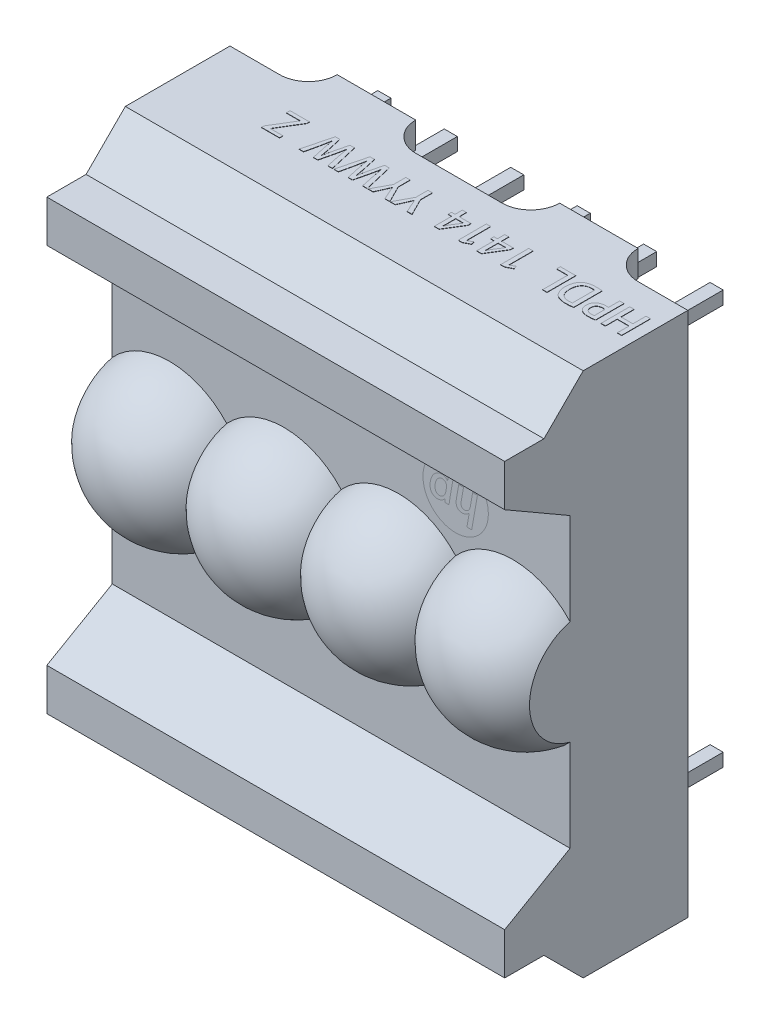
from build123d import *

# Parameters (mm, degrees)
EXTRUDE_1_DEPTH          = 8.75
SKETCH_2_W               = 3
SKETCH_2_H               = 1
EXTRUDE_2_DEPTH          = 1.1
FILLET_1_R               = 1.1
PATTERN_LINEAR_1_COUNT   = 4
PATTERN_LINEAR_1_PITCH   = 4.375
CUT_EXTRUDE_1_DEPTH      = 16.538465376
CUT_EXTRUDE_1_DEPTH_BACK = 16.538465376
SKETCH_5_W               = 0.5
SKETCH_5_H               = 0.5
EXTRUDE_3_DEPTH          = 3.5
WRAP_START               = 10.05
WRAP_1_DEPTH             = 0.01
WRAP_START_2             = -10.06
WRAP_2_DEPTH             = 0.01


# Read off the part's stored shape, not the designer's step: Перенос1, Перенос2
with BuildPart() as part:
    # Эскиз1 → Бобышка-Вытянуть1 (new, symmetric)
    with BuildSketch(Plane(origin=(0, 0, 0), x_dir=(0, 0, -1), z_dir=(1, 0, 0))):
        Polygon((0, 10.05), (0, -10.05), (-4, -10.05), (-5.5, -8.55), (-7, -8.55), (-7, -6.95), (-4.5, -5.506624327), (-4.5, 5.506624327), (-7, 6.95), (-7, 8.55), (-5.5, 8.55), (-4, 10.05), align=None)
    extrude(amount=EXTRUDE_1_DEPTH, both=True)

    # Эскиз2 → Бобышка-Вытянуть2 (add)
    with BuildSketch(Plane(origin=(0, 0, 0), x_dir=(-1, 0, 0), z_dir=(0, 0, -1))):
        with Locations((-4.25, 9.55)):
            Rectangle(SKETCH_2_W, SKETCH_2_H)
        with Locations((4.25, 9.55)):
            Rectangle(SKETCH_2_W, SKETCH_2_H)
        with Locations((4.25, -9.55)):
            Rectangle(SKETCH_2_W, SKETCH_2_H)
        with Locations((-4.25, -9.55)):
            Rectangle(SKETCH_2_W, SKETCH_2_H)
    extrude(amount=EXTRUDE_2_DEPTH)

    # Скругление1
    fillet_1_edges = [part.edges().sort_by_distance(p)[0] for p in [
        (-5.75, -9.55, 0),
        (-2.75, -9.55, 0),
        (2.75, -9.55, 0),
        (5.75, -9.55, 0),
        (-2.75, 9.55, 0),
        (-5.75, 9.55, 0),
        (2.75, 9.55, 0),
        (5.75, 9.55, 0),
    ]]
    fillet(fillet_1_edges, radius=FILLET_1_R - 0.0001)  # a hair under: the kernel refuses the full size

    # Эскиз3 → Повернуть1 (revolve)
    with BuildSketch(Plane(origin=(0, 0, 0), x_dir=(1, 0, 0), z_dir=(0, 1, 0))):
        with BuildLine():
            Line((-3.5625, -4), (-6.5625, -4))
            Line((-6.5625, -4), (-6.5625, -7))
            ThreePointArc((-6.5625, -7), (-4.441179656, -6.121320344), (-3.5625, -4))
        make_face()
    revolve_1 = revolve(axis=Axis((-6.5625, 0, 4), (0, 0, 1)))

    # Линейный массив1: Повернуть1 ×4
    with Locations(*[(i * PATTERN_LINEAR_1_PITCH, 0, 0) for i in range(1, PATTERN_LINEAR_1_COUNT)]):
        add(revolve_1)

    # Эскиз4 → Вырез-Вытянуть1 (cut, two sides: drawn at the far end of the back side and taken through both)
    with BuildSketch(Plane(origin=(0, 0, 0), x_dir=(-1, 0, 0), z_dir=(0, 0, -1)).offset(-CUT_EXTRUDE_1_DEPTH_BACK)):
        with BuildLine():
            Line((8.75, 2.053008463), (8.75, -2.053008463))
            ThreePointArc((8.75, -2.053008463), (9.5625, 0), (8.75, 2.053008463))
        make_face()
        with BuildLine():
            Line((-8.75, -2.053008463), (-8.75, 2.053008463))
            ThreePointArc((-8.75, 2.053008463), (-9.5625, 0), (-8.75, -2.053008463))
        make_face()
    extrude(amount=CUT_EXTRUDE_1_DEPTH + CUT_EXTRUDE_1_DEPTH_BACK, mode=Mode.SUBTRACT)

    # Эскиз5 → Бобышка-Вытянуть3 (add)
    with BuildSketch(Plane(origin=(0, 0, 0), x_dir=(-1, 0, 0), z_dir=(0, 0, -1))):
        with Locations((-1.27, 7.65)):
            Rectangle(SKETCH_5_W, SKETCH_5_H)
        with Locations((-3.81, 7.65)):
            Rectangle(SKETCH_5_W, SKETCH_5_H)
        with Locations((-6.35, 7.65)):
            Rectangle(SKETCH_5_W, SKETCH_5_H)
        with Locations((6.35, 7.65)):
            Rectangle(SKETCH_5_W, SKETCH_5_H)
        with Locations((3.81, 7.65)):
            Rectangle(SKETCH_5_W, SKETCH_5_H)
        with Locations((1.27, 7.65)):
            Rectangle(SKETCH_5_W, SKETCH_5_H)
        with Locations((1.27, -7.65)):
            Rectangle(SKETCH_5_W, SKETCH_5_H)
        with Locations((3.81, -7.65)):
            Rectangle(SKETCH_5_W, SKETCH_5_H)
        with Locations((6.35, -7.65)):
            Rectangle(SKETCH_5_W, SKETCH_5_H)
        with Locations((-6.35, -7.65)):
            Rectangle(SKETCH_5_W, SKETCH_5_H)
        with Locations((-3.81, -7.65)):
            Rectangle(SKETCH_5_W, SKETCH_5_H)
        with Locations((-1.27, -7.65)):
            Rectangle(SKETCH_5_W, SKETCH_5_H)
    extrude(amount=EXTRUDE_3_DEPTH)

    # Перенос1 outline → Перенос1 (add)
    # profile 1 of 13: a face of its own
    with BuildSketch(Plane(origin=(0, 0, 0), x_dir=(1, 0, 0), z_dir=(0, 1, 0)).offset(WRAP_START)):
        with BuildLine():
            Line((7.146040724, -1.00082936), (7.146040724, -1.432965852))
            add(Edge.make_bspline(
                [(7.146040724, -1.432965852), (7.138930586, -1.431805859), (7.124344074, -1.429426123), (7.101699216, -1.427237925), (7.077755807, -1.425949859), (7.061357972, -1.42597002), (7.052922323, -1.425980392)],
                knots=[0, 0, 0, 0, 0.231064057, 0.47403, 0.729421671, 1, 1, 1, 1], degree=3))
            add(Edge.make_bspline(
                [(7.052922323, -1.425980392), (7.040125113, -1.425985726), (7.014829113, -1.425996268), (6.977416587, -1.4295281), (6.940902355, -1.435167781), (6.90544502, -1.443995846), (6.870882927, -1.455263445), (6.837118822, -1.468834898), (6.80462632, -1.485661215), (6.772978761, -1.504400668), (6.743640608, -1.526683207), (6.717634267, -1.552834708), (6.695469319, -1.58282712), (6.677191902, -1.61660711), (6.662459761, -1.653931118), (6.651560364, -1.694920063), (6.644234423, -1.739522018), (6.642542385, -1.770565888), (6.641666667, -1.78663273)],
                knots=[0, 0, 0, 0, 0.062033556, 0.122620543, 0.182039484, 0.241075049, 0.299600981, 0.358249705, 0.417327145, 0.476896293, 0.536443737, 0.595475493, 0.65515493, 0.716670799, 0.781233164, 0.849306681, 0.922008251, 1, 1, 1, 1], degree=3))
            add(Edge.make_bspline(
                [(6.641666667, -1.78663273), (6.64193611, -1.799168045), (6.642462566, -1.823660339), (6.64801366, -1.85929824), (6.655830524, -1.893186185), (6.667515529, -1.924854104), (6.682096631, -1.954199325), (6.699116853, -1.981137322), (6.718829366, -2.005543704), (6.734179245, -2.019442881), (6.74183635, -2.02637632)],
                knots=[0, 0, 0, 0, 0.140120845, 0.273776985, 0.402646211, 0.528652362, 0.65039979, 0.768617699, 0.884577696, 1, 1, 1, 1], degree=3))
            add(Edge.make_bspline(
                [(6.74183635, -2.02637632), (6.750594015, -2.033445067), (6.768384877, -2.047804956), (6.798685354, -2.065543962), (6.831898331, -2.080705587), (6.868382506, -2.092821875), (6.907855304, -2.102735148), (6.95066167, -2.10896345), (6.99648846, -2.113381301), (7.028092669, -2.113720134), (7.044419306, -2.113895173)],
                knots=[0, 0, 0, 0, 0.104834302, 0.212966881, 0.326347598, 0.444798447, 0.570983137, 0.705383709, 0.847802131, 1, 1, 1, 1], degree=3))
            add(Edge.make_bspline(
                [(7.044419306, -2.113895173), (7.058176853, -2.113648138), (7.085004555, -2.11316641), (7.124140682, -2.111972654), (7.161135176, -2.110136312), (7.195973269, -2.107588492), (7.228695455, -2.104793592), (7.259262844, -2.101261765), (7.287617624, -2.097165039), (7.305739664, -2.093896236), (7.314441931, -2.092326546)],
                knots=[0, 0, 0, 0, 0.152200732, 0.2967968, 0.433082528, 0.561874949, 0.683166701, 0.796322853, 0.902193527, 1, 1, 1, 1], degree=3))
            Line((7.314441931, -2.092326546), (7.314442133, -1.00082936))
            Line((7.314442133, -1.00082936), (7.146040724, -1.00082936))
        make_face()
        with BuildLine():
            add(Edge.make_bspline(
                [(7.146040724, -1.973143353), (7.139560842, -1.974547843), (7.124845229, -1.977737398), (7.099617589, -1.980157222), (7.068934167, -1.982609875), (7.046569566, -1.983152666), (7.034464555, -1.983446456)],
                knots=[0, 0, 0, 0, 0.177098634, 0.402185583, 0.676428378, 1, 1, 1, 1], degree=3))
            add(Edge.make_bspline(
                [(7.034464555, -1.983446456), (7.026234157, -1.983269224), (7.010155829, -1.982922996), (6.986618725, -1.980746022), (6.964386413, -1.976514955), (6.94338431, -1.970910891), (6.923521615, -1.964032018), (6.905214114, -1.954854306), (6.887888654, -1.944645482), (6.872136834, -1.932483421), (6.85765969, -1.919068727), (6.84516224, -1.903763644), (6.834496718, -1.886938045), (6.826084321, -1.868345701), (6.818850869, -1.848451479), (6.814061162, -1.826765475), (6.810849584, -1.803594395), (6.810333756, -1.787612107), (6.810067873, -1.779374057)],
                knots=[0, 0, 0, 0, 0.071763063, 0.140191286, 0.205798206, 0.26880957, 0.329623633, 0.388655432, 0.447056189, 0.504677335, 0.56181099, 0.618763152, 0.676453604, 0.734966215, 0.796348077, 0.860677371, 0.928186335, 1, 1, 1, 1], degree=3))
            add(Edge.make_bspline(
                [(6.810067873, -1.779374057), (6.810343031, -1.770654909), (6.810877656, -1.753713817), (6.81397587, -1.729053021), (6.819195334, -1.705952), (6.826144117, -1.684366693), (6.835151354, -1.664378213), (6.846213217, -1.645994542), (6.859317922, -1.629160498), (6.874353663, -1.613918217), (6.891161668, -1.600468933), (6.909616098, -1.588773938), (6.929598546, -1.578762438), (6.951240493, -1.570717856), (6.974450514, -1.564515634), (6.999211391, -1.560019312), (7.025543792, -1.557021807), (7.043650389, -1.556629831), (7.052922323, -1.55642911)],
                knots=[0, 0, 0, 0, 0.069890136, 0.135794834, 0.198835574, 0.259458495, 0.317234587, 0.374151518, 0.43100639, 0.487815349, 0.545357184, 0.603149214, 0.662616723, 0.724156835, 0.787863615, 0.854913523, 0.925704857, 1, 1, 1, 1], degree=3))
            add(Edge.make_bspline(
                [(7.052922323, -1.55642911), (7.062049637, -1.556401757), (7.079350326, -1.556349911), (7.104011263, -1.557760252), (7.126019046, -1.560487307), (7.139631707, -1.563650327), (7.146040724, -1.565139517)],
                knots=[0, 0, 0, 0, 0.291877179, 0.553248887, 0.789663792, 1, 1, 1, 1], degree=3))
            Line((7.146040724, -1.565139517), (7.146040724, -1.973143353))
        make_face(mode=Mode.SUBTRACT)
    # profile 2 of 13: a face of its own
    with BuildSketch(Plane(origin=(0, 0, 0), x_dir=(1, 0, 0), z_dir=(0, 1, 0)).offset(WRAP_START)):
        with BuildLine():
            add(Edge.make_bspline(
                [(6.478243038, -1.000491945), (6.470155512, -0.999563154), (6.453505428, -0.997651018), (6.42768028, -0.994773226), (6.400131588, -0.992927203), (6.370836849, -0.990864823), (6.339846105, -0.989829774), (6.307152462, -0.988686166), (6.272789998, -0.988090997), (6.249283722, -0.988011846), (6.237254902, -0.987971342)],
                knots=[0, 0, 0, 0, 0.101141626, 0.208223938, 0.322774743, 0.444120446, 0.573052468, 0.707961851, 0.850555892, 1, 1, 1, 1], degree=3))
            add(Edge.make_bspline(
                [(6.237254902, -0.987971342), (6.213389797, -0.988406313), (6.166877024, -0.989254066), (6.099065847, -0.995921946), (6.035278132, -1.007055462), (5.984860212, -1.020017979), (5.946876554, -1.032873715), (5.919878468, -1.043447179), (5.89416092, -1.055005786), (5.869722789, -1.067753098), (5.846549305, -1.081543292), (5.82471458, -1.096659005), (5.803822909, -1.112425195), (5.79106689, -1.124188719), (5.784728507, -1.130033937)],
                knots=[0, 0, 0, 0, 0.147447792, 0.287373786, 0.420527555, 0.547241692, 0.608569665, 0.668221935, 0.726341882, 0.782705379, 0.838455281, 0.89283997, 0.946752883, 1, 1, 1, 1], degree=3))
            add(Edge.make_bspline(
                [(5.784728507, -1.130033937), (5.778994896, -1.136128083), (5.767474092, -1.148373327), (5.751212574, -1.167996162), (5.735904819, -1.188906859), (5.721563197, -1.21113416), (5.708376835, -1.234628468), (5.695821231, -1.259213362), (5.68423315, -1.285090418), (5.673698841, -1.312308174), (5.664038566, -1.340681436), (5.656108262, -1.370460917), (5.648973678, -1.40135574), (5.643212904, -1.433612617), (5.638589333, -1.46715955), (5.635661607, -1.502055933), (5.63344475, -1.538151266), (5.633095841, -1.562647261), (5.632918552, -1.575094268)],
                knots=[0, 0, 0, 0, 0.05204907, 0.10458455, 0.158436293, 0.213195834, 0.269050758, 0.32598649, 0.384897475, 0.445359646, 0.507515999, 0.571266459, 0.636998454, 0.704742779, 0.775058352, 0.847602401, 0.922563092, 1, 1, 1, 1], degree=3))
            Line((5.632918552, -1.575094268), (5.632918755, -1.576387017))
            add(Edge.make_bspline(
                [(5.632918755, -1.576387017), (5.632578634, -1.592621983), (5.631904394, -1.62480553), (5.635656964, -1.672639059), (5.642695983, -1.719534434), (5.654427707, -1.765269945), (5.669166466, -1.810296661), (5.688456417, -1.854108609), (5.711454882, -1.896944124), (5.733240125, -1.931812095), (5.753131624, -1.958678924), (5.770256649, -1.97751249), (5.788988029, -1.995261235), (5.809604608, -2.011691071), (5.832122742, -2.026733279), (5.856155049, -2.040999095), (5.88228384, -2.053529777), (5.910017079, -2.065159225), (5.93952713, -2.075515495), (5.97078093, -2.084574223), (6.003736824, -2.092782031), (6.038678968, -2.099230745), (6.075321811, -2.104890014), (6.113792152, -2.109190258), (6.153980128, -2.112336447), (6.181392524, -2.113368987), (6.195361991, -2.113895173)],
                knots=[0, 0, 0, 0, 0.054628992, 0.108294327, 0.16127986, 0.214047792, 0.267028215, 0.320590537, 0.374931155, 0.430577338, 0.458826281, 0.487329961, 0.516135975, 0.545608149, 0.57594133, 0.607229643, 0.63959486, 0.673389032, 0.708419925, 0.744794504, 0.782889377, 0.822684607, 0.864347665, 0.907672288, 0.952949426, 1, 1, 1, 1], degree=3))
            add(Edge.make_bspline(
                [(6.195361991, -2.113895173), (6.221224695, -2.113406559), (6.27146755, -2.112457338), (6.344504102, -2.107733054), (6.413037672, -2.101206308), (6.456975314, -2.09452406), (6.478242836, -2.091289593)],
                knots=[0, 0, 0, 0, 0.273171346, 0.53068342, 0.772832587, 1, 1, 1, 1], degree=3))
            Line((6.478242836, -2.091289593), (6.478243038, -1.000491945))
        make_face()
        with BuildLine():
            add(Edge.make_bspline(
                [(6.309841629, -1.971728074), (6.301706057, -1.973423478), (6.28375808, -1.977163729), (6.253676637, -1.979964106), (6.218357274, -1.982630977), (6.192949576, -1.98316273), (6.179392911, -1.983446456)],
                knots=[0, 0, 0, 0, 0.189916075, 0.418975973, 0.689985776, 1, 1, 1, 1], degree=3))
            add(Edge.make_bspline(
                [(6.179392911, -1.983446456), (6.164721219, -1.983152968), (6.136187583, -1.98258219), (6.094777656, -1.977446834), (6.055919284, -1.969511005), (6.019671882, -1.95803044), (5.985814987, -1.943528319), (5.954509934, -1.925650701), (5.925962587, -1.904336861), (5.899993047, -1.879907692), (5.877001366, -1.852186131), (5.856640603, -1.821478044), (5.839685261, -1.7874433), (5.825816524, -1.750376516), (5.815076667, -1.710214692), (5.807259151, -1.667008477), (5.802504295, -1.620616892), (5.801722488, -1.588655133), (5.801319759, -1.572190799)],
                knots=[0, 0, 0, 0, 0.069093005, 0.134372678, 0.19626618, 0.25569784, 0.3131725, 0.369483828, 0.425110076, 0.480633262, 0.537051851, 0.594410131, 0.653834651, 0.715776118, 0.78055915, 0.849421501, 0.922433093, 1, 1, 1, 1], degree=3))
            add(Edge.make_bspline(
                [(5.801319759, -1.572190799), (5.801763355, -1.553580861), (5.802622625, -1.517532384), (5.807930873, -1.465299727), (5.815891308, -1.416669009), (5.827848233, -1.371814152), (5.842670852, -1.33057814), (5.860707855, -1.292935955), (5.882141509, -1.259034209), (5.907023538, -1.229001191), (5.934746275, -1.202601617), (5.964958263, -1.179504636), (5.998103458, -1.16042306), (6.033638013, -1.144547956), (6.071938865, -1.132546803), (6.112720565, -1.124144237), (6.156104009, -1.11905451), (6.185876854, -1.118635351), (6.201168929, -1.11842006)],
                knots=[0, 0, 0, 0, 0.080855983, 0.156622498, 0.227929156, 0.294740239, 0.358024074, 0.418075267, 0.47573816, 0.53184994, 0.587087433, 0.641756032, 0.696674093, 0.752882266, 0.810545159, 0.870692432, 0.933584412, 1, 1, 1, 1], degree=3))
            add(Edge.make_bspline(
                [(6.201168929, -1.11842006), (6.211193979, -1.118423333), (6.230558872, -1.118429655), (6.258707118, -1.11951114), (6.284938011, -1.121245116), (6.301760071, -1.123259338), (6.309841629, -1.124226998)],
                knots=[0, 0, 0, 0, 0.276126296, 0.533379547, 0.775828852, 1, 1, 1, 1], degree=3))
            Line((6.309841629, -1.124226998), (6.309841629, -1.971728074))
        make_face(mode=Mode.SUBTRACT)
    # profile 3 of 13: a face of its own
    with BuildSketch(Plane(origin=(0, 0, 0), x_dir=(1, 0, 0), z_dir=(0, 1, 0)).offset(WRAP_START)):
        with BuildLine():
            Line((-0.334041341, -2.10082936), (-0.203592218, -1.814716138))
            add(Edge.make_bspline(
                [(-0.203592218, -1.814716138), (-0.194743379, -1.794859797), (-0.177337048, -1.755800882), (-0.15212669, -1.697927978), (-0.128737109, -1.641531531), (-0.113904961, -1.604352657), (-0.106617647, -1.586085973)],
                knots=[0, 0, 0, 0, 0.262578088, 0.516510829, 0.762452628, 1, 1, 1, 1], degree=3))
            Line((-0.106617647, -1.586085973), (-0.103713975, -1.586080099))
            add(Edge.make_bspline(
                [(-0.103713975, -1.586080099), (-0.096458175, -1.605149848), (-0.082041734, -1.643039246), (-0.05782313, -1.699064564), (-0.032697964, -1.755745776), (-0.015458603, -1.793901812), (-0.006655354, -1.813386124)],
                knots=[0, 0, 0, 0, 0.24757352, 0.491900122, 0.740539698, 1, 1, 1, 1], degree=3))
            Line((-0.006655354, -1.813386124), (0.122494944, -2.10082936))
            Line((0.122494944, -2.10082936), (0.310284341, -2.10082936))
            Line((0.310284341, -2.10082936), (-0.012254699, -1.460977362))
            Line((-0.012254699, -1.460977362), (-0.012254699, -1.00082936))
            Line((-0.012254699, -1.00082936), (-0.180656109, -1.00082936))
            Line((-0.180656109, -1.00082936), (-0.180656109, -1.465291249))
            Line((-0.180656109, -1.465291249), (-0.520397231, -2.10082936))
            Line((-0.520397231, -2.10082936), (-0.334041341, -2.10082936))
        make_face()
    # profile 4 of 13: a face of its own
    with BuildSketch(Plane(origin=(0, 0, 0), x_dir=(1, 0, 0), z_dir=(0, 1, 0)).offset(WRAP_START)):
        with BuildLine():
            Line((-1.183513438, -2.10082936), (-1.053064315, -1.814716138))
            add(Edge.make_bspline(
                [(-1.053064315, -1.814716138), (-1.044215476, -1.794859797), (-1.026809144, -1.755800882), (-1.001598786, -1.697927978), (-0.978209205, -1.641531531), (-0.963377058, -1.604352657), (-0.956089744, -1.586085973)],
                knots=[0, 0, 0, 0, 0.262578088, 0.516510829, 0.762452628, 1, 1, 1, 1], degree=3))
            Line((-0.956089744, -1.586085973), (-0.953186072, -1.586080099))
            add(Edge.make_bspline(
                [(-0.953186072, -1.586080099), (-0.945930272, -1.605149848), (-0.931513831, -1.643039246), (-0.907295226, -1.699064564), (-0.88217006, -1.755745776), (-0.8649307, -1.793901812), (-0.856127451, -1.813386124)],
                knots=[0, 0, 0, 0, 0.24757352, 0.491900122, 0.740539698, 1, 1, 1, 1], degree=3))
            Line((-0.856127451, -1.813386124), (-0.726977152, -2.10082936))
            Line((-0.726977152, -2.10082936), (-0.539187756, -2.10082936))
            Line((-0.539187756, -2.10082936), (-0.861726796, -1.460977362))
            Line((-0.861726796, -1.460977362), (-0.861726796, -1.00082936))
            Line((-0.861726796, -1.00082936), (-1.030128205, -1.00082936))
            Line((-1.030128205, -1.00082936), (-1.030128205, -1.465291249))
            Line((-1.030128205, -1.465291249), (-1.369869328, -2.10082936))
            Line((-1.369869328, -2.10082936), (-1.183513438, -2.10082936))
        make_face()
    # profile 5 of 13: a face of its own
    with BuildSketch(Plane(origin=(0, 0, 0), x_dir=(1, 0, 0), z_dir=(0, 1, 0)).offset(WRAP_START)):
        with BuildLine():
            Line((-2.50870586, -2.10082936), (-2.391590092, -1.581766212))
            add(Edge.make_bspline(
                [(-2.391590092, -1.581766212), (-2.384629673, -1.549207755), (-2.370858285, -1.484789912), (-2.351506377, -1.388574907), (-2.333375244, -1.293012847), (-2.323700815, -1.229062007), (-2.318853695, -1.197021116)],
                knots=[0, 0, 0, 0, 0.255035152, 0.504594381, 0.751790013, 1, 1, 1, 1], degree=3))
            Line((-2.318853695, -1.197021116), (-2.314465074, -1.197021116))
            add(Edge.make_bspline(
                [(-2.314465074, -1.197021116), (-2.310008199, -1.228570078), (-2.301048923, -1.291990273), (-2.284551605, -1.387124967), (-2.266810729, -1.48297434), (-2.252996698, -1.546783608), (-2.246059578, -1.5788273)],
                knots=[0, 0, 0, 0, 0.246349267, 0.495214993, 0.746507429, 1, 1, 1, 1], degree=3))
            Line((-2.246059578, -1.5788273), (-2.131650218, -2.10082936))
            Line((-2.131650218, -2.10082936), (-1.965974254, -2.10082936))
            Line((-1.965974254, -2.10082936), (-1.841717281, -1.581526619))
            add(Edge.make_bspline(
                [(-1.841717281, -1.581526619), (-1.833939292, -1.547377698), (-1.81868949, -1.480424103), (-1.796502263, -1.382059236), (-1.776756157, -1.287759756), (-1.766697732, -1.225888698), (-1.761802413, -1.195776772)],
                knots=[0, 0, 0, 0, 0.266653103, 0.5228096, 0.767756971, 1, 1, 1, 1], degree=3))
            Line((-1.761802413, -1.195776772), (-1.758879299, -1.195575052))
            add(Edge.make_bspline(
                [(-1.758879299, -1.195575052), (-1.756484236, -1.210162658), (-1.75162365, -1.239767029), (-1.743867014, -1.284892182), (-1.735875712, -1.33151562), (-1.724080775, -1.39607691), (-1.708782344, -1.478750712), (-1.695644161, -1.54524314), (-1.689008296, -1.5788273)],
                knots=[0, 0, 0, 0, 0.113834154, 0.231017254, 0.352577828, 0.47808622, 0.736390492, 1, 1, 1, 1], degree=3))
            Line((-1.689008296, -1.5788273), (-1.580349165, -2.10082936))
            Line((-1.580349165, -2.10082936), (-1.404675514, -2.10082936))
            Line((-1.404675514, -2.10082936), (-1.660330665, -1.002073906))
            Line((-1.660330665, -1.002073906), (-1.834576075, -1.002073906))
            Line((-1.834576075, -1.002073906), (-1.964546013, -1.53274607))
            add(Edge.make_bspline(
                [(-1.964546013, -1.53274607), (-1.968646529, -1.548782491), (-1.976689248, -1.580236193), (-1.987495766, -1.626945937), (-1.998263329, -1.671997441), (-2.010921511, -1.730416581), (-2.02513366, -1.80283914), (-2.034288899, -1.860985326), (-2.03887632, -1.890120664)],
                knots=[0, 0, 0, 0, 0.135972051, 0.266694461, 0.393839895, 0.516481797, 0.757723297, 1, 1, 1, 1], degree=3))
            Line((-2.03887632, -1.890120664), (-2.043099271, -1.890120259))
            add(Edge.make_bspline(
                [(-2.043099271, -1.890120259), (-2.046661067, -1.860917078), (-2.053793837, -1.802435464), (-2.068514169, -1.714451574), (-2.085869582, -1.624513179), (-2.099226105, -1.56386619), (-2.10607089, -1.532786576)],
                knots=[0, 0, 0, 0, 0.24309753, 0.486821487, 0.737012661, 1, 1, 1, 1], degree=3))
            Line((-2.10607089, -1.532786576), (-2.224485887, -1.00082936))
            Line((-2.224485887, -1.00082936), (-2.397303056, -1.00082936))
            Line((-2.397303056, -1.00082936), (-2.677224331, -2.10082936))
            Line((-2.677224331, -2.10082936), (-2.50870586, -2.10082936))
        make_face()
    # profile 6 of 13: a face of its own
    with BuildSketch(Plane(origin=(0, 0, 0), x_dir=(1, 0, 0), z_dir=(0, 1, 0)).offset(WRAP_START)):
        with BuildLine():
            Line((-3.83600601, -2.10082936), (-3.718890243, -1.581766212))
            add(Edge.make_bspline(
                [(-3.718890243, -1.581766212), (-3.711929824, -1.549207755), (-3.698158436, -1.484789912), (-3.678806528, -1.388574907), (-3.660675395, -1.293012847), (-3.651000965, -1.229062007), (-3.646153846, -1.197021116)],
                knots=[0, 0, 0, 0, 0.255035152, 0.504594381, 0.751790013, 1, 1, 1, 1], degree=3))
            Line((-3.646153846, -1.197021116), (-3.641765225, -1.197021116))
            add(Edge.make_bspline(
                [(-3.641765225, -1.197021116), (-3.63730835, -1.228570078), (-3.628349074, -1.291990273), (-3.611851756, -1.387124967), (-3.594110879, -1.48297434), (-3.580296849, -1.546783608), (-3.573359729, -1.5788273)],
                knots=[0, 0, 0, 0, 0.246349267, 0.495214993, 0.746507429, 1, 1, 1, 1], degree=3))
            Line((-3.573359729, -1.5788273), (-3.458950368, -2.10082936))
            Line((-3.458950368, -2.10082936), (-3.293274404, -2.10082936))
            Line((-3.293274404, -2.10082936), (-3.169017432, -1.581526619))
            add(Edge.make_bspline(
                [(-3.169017432, -1.581526619), (-3.161239443, -1.547377698), (-3.145989641, -1.480424103), (-3.123802413, -1.382059236), (-3.104056308, -1.287759756), (-3.093997883, -1.225888698), (-3.089102564, -1.195776772)],
                knots=[0, 0, 0, 0, 0.266653103, 0.5228096, 0.767756971, 1, 1, 1, 1], degree=3))
            Line((-3.089102564, -1.195776772), (-3.08617945, -1.195575052))
            add(Edge.make_bspline(
                [(-3.08617945, -1.195575052), (-3.083784387, -1.210162658), (-3.078923801, -1.239767029), (-3.071167165, -1.284892182), (-3.063175862, -1.33151562), (-3.051380925, -1.39607691), (-3.036082495, -1.478750712), (-3.022944312, -1.54524314), (-3.016308446, -1.5788273)],
                knots=[0, 0, 0, 0, 0.113834154, 0.231017254, 0.352577828, 0.47808622, 0.736390492, 1, 1, 1, 1], degree=3))
            Line((-3.016308446, -1.5788273), (-2.907649316, -2.10082936))
            Line((-2.907649316, -2.10082936), (-2.731975665, -2.10082936))
            Line((-2.731975665, -2.10082936), (-2.987630816, -1.002073906))
            Line((-2.987630816, -1.002073906), (-3.161876226, -1.002073906))
            Line((-3.161876226, -1.002073906), (-3.291846163, -1.53274607))
            add(Edge.make_bspline(
                [(-3.291846163, -1.53274607), (-3.29594668, -1.548782491), (-3.303989399, -1.580236193), (-3.314795916, -1.626945937), (-3.32556348, -1.671997441), (-3.338221662, -1.730416581), (-3.352433811, -1.80283914), (-3.36158905, -1.860985326), (-3.366176471, -1.890120664)],
                knots=[0, 0, 0, 0, 0.135972051, 0.266694461, 0.393839895, 0.516481797, 0.757723297, 1, 1, 1, 1], degree=3))
            Line((-3.366176471, -1.890120664), (-3.370399422, -1.890120259))
            add(Edge.make_bspline(
                [(-3.370399422, -1.890120259), (-3.373961218, -1.860917078), (-3.381093988, -1.802435464), (-3.39581432, -1.714451574), (-3.413169733, -1.624513179), (-3.426526256, -1.56386619), (-3.433371041, -1.532786576)],
                knots=[0, 0, 0, 0, 0.24309753, 0.486821487, 0.737012661, 1, 1, 1, 1], degree=3))
            Line((-3.433371041, -1.532786576), (-3.551786038, -1.00082936))
            Line((-3.551786038, -1.00082936), (-3.724603207, -1.00082936))
            Line((-3.724603207, -1.00082936), (-4.004524482, -2.10082936))
            Line((-4.004524482, -2.10082936), (-3.83600601, -2.10082936))
        make_face()
    # profile 7 of 13: a face of its own
    with BuildSketch(Plane(origin=(0, 0, 0), x_dir=(1, 0, 0), z_dir=(0, 1, 0)).offset(WRAP_START)):
        Polygon((7.699359379, -2.10082936), (7.699359379, -1.649547309), (8.154788839, -1.649547309), (8.154788839, -2.10082936), (8.323190248, -2.10082936), (8.323190248, -1.00082936), (8.154788839, -1.00082936), (8.154788839, -1.505203417), (7.699359379, -1.505203417), (7.699359379, -1.00082936), (7.53095797, -1.00082936), (7.53095797, -2.10082936), align=None)
    # profile 8 of 13: a face of its own
    with BuildSketch(Plane(origin=(0, 0, 0), x_dir=(1, 0, 0), z_dir=(0, 1, 0)).offset(WRAP_START)):
        Polygon((5.301093514, -2.10082936), (5.469494923, -2.10082936), (5.469494923, -1.002073906), (4.878208995, -1.002073906), (4.878208995, -1.14392911), (5.301093514, -1.14392911), align=None)
    # profile 9 of 13: a face of its own
    with BuildSketch(Plane(origin=(0, 0, 0), x_dir=(1, 0, 0), z_dir=(0, 1, 0)).offset(WRAP_START)):
        Polygon((3.836915738, -1.00082936), (3.668514329, -1.00082936), (3.668514329, -2.074283357), (3.81456251, -2.074283357), (4.059109299, -1.950366432), (4.021838121, -1.829365128), (3.839782752, -1.929939263), (3.836915738, -1.929939263), align=None)
    # profile 10 of 13: a face of its own
    with BuildSketch(Plane(origin=(0, 0, 0), x_dir=(1, 0, 0), z_dir=(0, 1, 0)).offset(WRAP_START)):
        Polygon((2.908367653, -1.00082936), (2.752115407, -1.00082936), (2.752115407, -1.279873478), (2.617365763, -1.279873478), (2.617365763, -1.410322398), (2.752115407, -1.410322398), (2.752115407, -2.073600831), (2.93703779, -2.073600831), (3.35992231, -1.39104722), (3.35992231, -1.279873478), (2.908367653, -1.279873478), align=None)
        with BuildLine():
            Line((3.203670063, -1.413163083), (2.997245077, -1.739841835))
            add(Edge.make_bspline(
                [(2.997245077, -1.739841835), (2.989820256, -1.753912699), (2.974978539, -1.782039405), (2.952553381, -1.824972093), (2.929933884, -1.870181169), (2.914694254, -1.901307925), (2.906768477, -1.917496229)],
                knots=[0, 0, 0, 0, 0.239388942, 0.478522302, 0.728791543, 1, 1, 1, 1], degree=3))
            Line((2.906768477, -1.917496229), (2.901200119, -1.917348585))
            add(Edge.make_bspline(
                [(2.901200119, -1.917348585), (2.903191862, -1.886368672), (2.907171419, -1.824469973), (2.907870844, -1.762447452), (2.908220211, -1.731466817)],
                knots=[0, 0, 0, 0, 0.500493776, 1, 1, 1, 1], degree=3))
            Line((2.908220211, -1.731466817), (2.908367653, -1.410322398))
            Line((2.908367653, -1.410322398), (3.203670063, -1.410322398))
            Line((3.203670063, -1.410322398), (3.203670063, -1.413163083))
        make_face(mode=Mode.SUBTRACT)
    # profile 11 of 13: a face of its own
    with BuildSketch(Plane(origin=(0, 0, 0), x_dir=(1, 0, 0), z_dir=(0, 1, 0)).offset(WRAP_START)):
        Polygon((2.217609554, -1.00082936), (2.049208145, -1.00082936), (2.049208145, -2.074283357), (2.195256326, -2.074283357), (2.439803115, -1.950366432), (2.402531937, -1.829365128), (2.220476568, -1.929939263), (2.217609554, -1.929939263), align=None)
    # profile 12 of 13: a face of its own
    with BuildSketch(Plane(origin=(0, 0, 0), x_dir=(1, 0, 0), z_dir=(0, 1, 0)).offset(WRAP_START)):
        Polygon((1.289061469, -1.00082936), (1.132809223, -1.00082936), (1.132809223, -1.279873478), (0.998059579, -1.279873478), (0.998059579, -1.410322398), (1.132809223, -1.410322398), (1.132809223, -2.073600831), (1.317731606, -2.073600831), (1.740616126, -1.39104722), (1.740616126, -1.279873478), (1.289061469, -1.279873478), align=None)
        with BuildLine():
            Line((1.584363879, -1.413163083), (1.377938893, -1.739841835))
            add(Edge.make_bspline(
                [(1.377938893, -1.739841835), (1.370514072, -1.753912699), (1.355672355, -1.782039405), (1.333247197, -1.824972093), (1.3106277, -1.870181169), (1.29538807, -1.901307925), (1.287462293, -1.917496229)],
                knots=[0, 0, 0, 0, 0.239388942, 0.478522302, 0.728791543, 1, 1, 1, 1], degree=3))
            Line((1.287462293, -1.917496229), (1.281893935, -1.917348585))
            add(Edge.make_bspline(
                [(1.281893935, -1.917348585), (1.283885678, -1.886368672), (1.287865235, -1.824469973), (1.28856466, -1.762447452), (1.288914027, -1.731466817)],
                knots=[0, 0, 0, 0, 0.500493776, 1, 1, 1, 1], degree=3))
            Line((1.288914027, -1.731466817), (1.289061469, -1.410322398))
            Line((1.289061469, -1.410322398), (1.584363879, -1.410322398))
            Line((1.584363879, -1.410322398), (1.584363879, -1.413163083))
        make_face(mode=Mode.SUBTRACT)
    # profile 13 of 13: a face of its own
    with BuildSketch(Plane(origin=(0, 0, 0), x_dir=(1, 0, 0), z_dir=(0, 1, 0)).offset(WRAP_START)):
        Polygon((-4.709652889, -1.002073906), (-5.451281849, -1.002073906), (-5.451281849, -1.14392911), (-4.92378819, -1.14392911), (-4.92378819, -1.149726327), (-5.445654352, -2.005033918), (-5.445654352, -2.100518274), (-4.755032556, -2.100518274), (-4.755032556, -1.970069151), (-5.23719151, -1.970069151), (-5.23719151, -1.964235276), (-4.709652889, -1.09760768), align=None)
    extrude(amount=WRAP_1_DEPTH)

    # Перенос2 outline → Перенос2 (add)
    # profile 1 of 13: a face of its own
    with BuildSketch(Plane(origin=(0, 0, 0), x_dir=(1, 0, 0), z_dir=(0, 1, 0)).offset(WRAP_START_2)):
        with BuildLine():
            add(Edge.make_bspline(
                [(-7.146040724, -1.432965852), (-7.138930586, -1.431805859), (-7.124344074, -1.429426123), (-7.101699216, -1.427237925), (-7.077755807, -1.425949859), (-7.061357972, -1.42597002), (-7.052922323, -1.425980392)],
                knots=[0, 0, 0, 0, 0.231064057, 0.47403, 0.729421671, 1, 1, 1, 1], degree=3))
            Line((-7.146040724, -1.432965852), (-7.146040724, -1.00082936))
            Line((-7.146040724, -1.00082936), (-7.314442133, -1.00082936))
            Line((-7.314442133, -1.00082936), (-7.314441931, -2.092326546))
            add(Edge.make_bspline(
                [(-7.044419306, -2.113895173), (-7.058176853, -2.113648138), (-7.085004555, -2.11316641), (-7.124140682, -2.111972654), (-7.161135176, -2.110136312), (-7.195973269, -2.107588492), (-7.228695455, -2.104793592), (-7.259262844, -2.101261765), (-7.287617624, -2.097165039), (-7.305739664, -2.093896236), (-7.314441931, -2.092326546)],
                knots=[0, 0, 0, 0, 0.152200732, 0.2967968, 0.433082528, 0.561874949, 0.683166701, 0.796322853, 0.902193527, 1, 1, 1, 1], degree=3))
            add(Edge.make_bspline(
                [(-6.74183635, -2.02637632), (-6.750594015, -2.033445067), (-6.768384877, -2.047804956), (-6.798685354, -2.065543962), (-6.831898331, -2.080705587), (-6.868382506, -2.092821875), (-6.907855304, -2.102735148), (-6.95066167, -2.10896345), (-6.99648846, -2.113381301), (-7.028092669, -2.113720134), (-7.044419306, -2.113895173)],
                knots=[0, 0, 0, 0, 0.104834302, 0.212966881, 0.326347598, 0.444798447, 0.570983137, 0.705383709, 0.847802131, 1, 1, 1, 1], degree=3))
            add(Edge.make_bspline(
                [(-6.641666667, -1.78663273), (-6.64193611, -1.799168045), (-6.642462566, -1.823660339), (-6.64801366, -1.85929824), (-6.655830524, -1.893186185), (-6.667515529, -1.924854104), (-6.682096631, -1.954199325), (-6.699116853, -1.981137322), (-6.718829366, -2.005543704), (-6.734179245, -2.019442881), (-6.74183635, -2.02637632)],
                knots=[0, 0, 0, 0, 0.140120845, 0.273776985, 0.402646211, 0.528652362, 0.65039979, 0.768617699, 0.884577696, 1, 1, 1, 1], degree=3))
            add(Edge.make_bspline(
                [(-7.052922323, -1.425980392), (-7.040125113, -1.425985726), (-7.014829113, -1.425996268), (-6.977416587, -1.4295281), (-6.940902355, -1.435167781), (-6.90544502, -1.443995846), (-6.870882927, -1.455263445), (-6.837118822, -1.468834898), (-6.80462632, -1.485661215), (-6.772978761, -1.504400668), (-6.743640608, -1.526683207), (-6.717634267, -1.552834708), (-6.695469319, -1.58282712), (-6.677191902, -1.61660711), (-6.662459761, -1.653931118), (-6.651560364, -1.694920063), (-6.644234423, -1.739522018), (-6.642542385, -1.770565888), (-6.641666667, -1.78663273)],
                knots=[0, 0, 0, 0, 0.062033556, 0.122620543, 0.182039484, 0.241075049, 0.299600981, 0.358249705, 0.417327145, 0.476896293, 0.536443737, 0.595475493, 0.65515493, 0.716670799, 0.781233164, 0.849306681, 0.922008251, 1, 1, 1, 1], degree=3))
        make_face()
        with BuildLine():
            add(Edge.make_bspline(
                [(-7.034464555, -1.983446456), (-7.026234157, -1.983269224), (-7.010155829, -1.982922996), (-6.986618725, -1.980746022), (-6.964386413, -1.976514955), (-6.94338431, -1.970910891), (-6.923521615, -1.964032018), (-6.905214114, -1.954854306), (-6.887888654, -1.944645482), (-6.872136834, -1.932483421), (-6.85765969, -1.919068727), (-6.84516224, -1.903763644), (-6.834496718, -1.886938045), (-6.826084321, -1.868345701), (-6.818850869, -1.848451479), (-6.814061162, -1.826765475), (-6.810849584, -1.803594395), (-6.810333756, -1.787612107), (-6.810067873, -1.779374057)],
                knots=[0, 0, 0, 0, 0.071763063, 0.140191286, 0.205798206, 0.26880957, 0.329623633, 0.388655432, 0.447056189, 0.504677335, 0.56181099, 0.618763152, 0.676453604, 0.734966215, 0.796348077, 0.860677371, 0.928186335, 1, 1, 1, 1], degree=3))
            add(Edge.make_bspline(
                [(-7.146040724, -1.973143353), (-7.139560842, -1.974547843), (-7.124845229, -1.977737398), (-7.099617589, -1.980157222), (-7.068934167, -1.982609875), (-7.046569566, -1.983152666), (-7.034464555, -1.983446456)],
                knots=[0, 0, 0, 0, 0.177098634, 0.402185583, 0.676428378, 1, 1, 1, 1], degree=3))
            Line((-7.146040724, -1.973143353), (-7.146040724, -1.565139517))
            add(Edge.make_bspline(
                [(-7.052922323, -1.55642911), (-7.062049637, -1.556401757), (-7.079350326, -1.556349911), (-7.104011263, -1.557760252), (-7.126019046, -1.560487307), (-7.139631707, -1.563650327), (-7.146040724, -1.565139517)],
                knots=[0, 0, 0, 0, 0.291877179, 0.553248887, 0.789663792, 1, 1, 1, 1], degree=3))
            add(Edge.make_bspline(
                [(-6.810067873, -1.779374057), (-6.810343031, -1.770654909), (-6.810877656, -1.753713817), (-6.81397587, -1.729053021), (-6.819195334, -1.705952), (-6.826144117, -1.684366693), (-6.835151354, -1.664378213), (-6.846213217, -1.645994542), (-6.859317922, -1.629160498), (-6.874353663, -1.613918217), (-6.891161668, -1.600468933), (-6.909616098, -1.588773938), (-6.929598546, -1.578762438), (-6.951240493, -1.570717856), (-6.974450514, -1.564515634), (-6.999211391, -1.560019312), (-7.025543792, -1.557021807), (-7.043650389, -1.556629831), (-7.052922323, -1.55642911)],
                knots=[0, 0, 0, 0, 0.069890136, 0.135794834, 0.198835574, 0.259458495, 0.317234587, 0.374151518, 0.43100639, 0.487815349, 0.545357184, 0.603149214, 0.662616723, 0.724156835, 0.787863615, 0.854913523, 0.925704857, 1, 1, 1, 1], degree=3))
        make_face(mode=Mode.SUBTRACT)
    # profile 2 of 13: a face of its own
    with BuildSketch(Plane(origin=(0, 0, 0), x_dir=(1, 0, 0), z_dir=(0, 1, 0)).offset(WRAP_START_2)):
        with BuildLine():
            add(Edge.make_bspline(
                [(-6.237254902, -0.987971342), (-6.213389797, -0.988406313), (-6.166877024, -0.989254066), (-6.099065847, -0.995921946), (-6.035278132, -1.007055462), (-5.984860212, -1.020017979), (-5.946876554, -1.032873715), (-5.919878468, -1.043447179), (-5.89416092, -1.055005786), (-5.869722789, -1.067753098), (-5.846549305, -1.081543292), (-5.82471458, -1.096659005), (-5.803822909, -1.112425195), (-5.79106689, -1.124188719), (-5.784728507, -1.130033937)],
                knots=[0, 0, 0, 0, 0.147447792, 0.287373786, 0.420527555, 0.547241692, 0.608569665, 0.668221935, 0.726341882, 0.782705379, 0.838455281, 0.89283997, 0.946752883, 1, 1, 1, 1], degree=3))
            add(Edge.make_bspline(
                [(-6.478243038, -1.000491945), (-6.470155512, -0.999563154), (-6.453505428, -0.997651018), (-6.42768028, -0.994773226), (-6.400131588, -0.992927203), (-6.370836849, -0.990864823), (-6.339846105, -0.989829774), (-6.307152462, -0.988686166), (-6.272789998, -0.988090997), (-6.249283722, -0.988011846), (-6.237254902, -0.987971342)],
                knots=[0, 0, 0, 0, 0.101141626, 0.208223938, 0.322774743, 0.444120446, 0.573052468, 0.707961851, 0.850555892, 1, 1, 1, 1], degree=3))
            Line((-6.478243038, -1.000491945), (-6.478242836, -2.091289593))
            add(Edge.make_bspline(
                [(-6.195361991, -2.113895173), (-6.221224695, -2.113406559), (-6.27146755, -2.112457338), (-6.344504102, -2.107733054), (-6.413037672, -2.101206308), (-6.456975314, -2.09452406), (-6.478242836, -2.091289593)],
                knots=[0, 0, 0, 0, 0.273171346, 0.53068342, 0.772832587, 1, 1, 1, 1], degree=3))
            add(Edge.make_bspline(
                [(-5.632918755, -1.576387017), (-5.632578634, -1.592621983), (-5.631904394, -1.62480553), (-5.635656964, -1.672639059), (-5.642695983, -1.719534434), (-5.654427707, -1.765269945), (-5.669166466, -1.810296661), (-5.688456417, -1.854108609), (-5.711454882, -1.896944124), (-5.733240125, -1.931812095), (-5.753131624, -1.958678924), (-5.770256649, -1.97751249), (-5.788988029, -1.995261235), (-5.809604608, -2.011691071), (-5.832122742, -2.026733279), (-5.856155049, -2.040999095), (-5.88228384, -2.053529777), (-5.910017079, -2.065159225), (-5.93952713, -2.075515495), (-5.97078093, -2.084574223), (-6.003736824, -2.092782031), (-6.038678968, -2.099230745), (-6.075321811, -2.104890014), (-6.113792152, -2.109190258), (-6.153980128, -2.112336447), (-6.181392524, -2.113368987), (-6.195361991, -2.113895173)],
                knots=[0, 0, 0, 0, 0.054628992, 0.108294327, 0.16127986, 0.214047792, 0.267028215, 0.320590537, 0.374931155, 0.430577338, 0.458826281, 0.487329961, 0.516135975, 0.545608149, 0.57594133, 0.607229643, 0.63959486, 0.673389032, 0.708419925, 0.744794504, 0.782889377, 0.822684607, 0.864347665, 0.907672288, 0.952949426, 1, 1, 1, 1], degree=3))
            Line((-5.632918755, -1.576387017), (-5.632918552, -1.575094268))
            add(Edge.make_bspline(
                [(-5.784728507, -1.130033937), (-5.778994896, -1.136128083), (-5.767474092, -1.148373327), (-5.751212574, -1.167996162), (-5.735904819, -1.188906859), (-5.721563197, -1.21113416), (-5.708376835, -1.234628468), (-5.695821231, -1.259213362), (-5.68423315, -1.285090418), (-5.673698841, -1.312308174), (-5.664038566, -1.340681436), (-5.656108262, -1.370460917), (-5.648973678, -1.40135574), (-5.643212904, -1.433612617), (-5.638589333, -1.46715955), (-5.635661607, -1.502055933), (-5.63344475, -1.538151266), (-5.633095841, -1.562647261), (-5.632918552, -1.575094268)],
                knots=[0, 0, 0, 0, 0.05204907, 0.10458455, 0.158436293, 0.213195834, 0.269050758, 0.32598649, 0.384897475, 0.445359646, 0.507515999, 0.571266459, 0.636998454, 0.704742779, 0.775058352, 0.847602401, 0.922563092, 1, 1, 1, 1], degree=3))
        make_face()
        with BuildLine():
            add(Edge.make_bspline(
                [(-6.179392911, -1.983446456), (-6.164721219, -1.983152968), (-6.136187583, -1.98258219), (-6.094777656, -1.977446834), (-6.055919284, -1.969511005), (-6.019671882, -1.95803044), (-5.985814987, -1.943528319), (-5.954509934, -1.925650701), (-5.925962587, -1.904336861), (-5.899993047, -1.879907692), (-5.877001366, -1.852186131), (-5.856640603, -1.821478044), (-5.839685261, -1.7874433), (-5.825816524, -1.750376516), (-5.815076667, -1.710214692), (-5.807259151, -1.667008477), (-5.802504295, -1.620616892), (-5.801722488, -1.588655133), (-5.801319759, -1.572190799)],
                knots=[0, 0, 0, 0, 0.069093005, 0.134372678, 0.19626618, 0.25569784, 0.3131725, 0.369483828, 0.425110076, 0.480633262, 0.537051851, 0.594410131, 0.653834651, 0.715776118, 0.78055915, 0.849421501, 0.922433093, 1, 1, 1, 1], degree=3))
            add(Edge.make_bspline(
                [(-6.309841629, -1.971728074), (-6.301706057, -1.973423478), (-6.28375808, -1.977163729), (-6.253676637, -1.979964106), (-6.218357274, -1.982630977), (-6.192949576, -1.98316273), (-6.179392911, -1.983446456)],
                knots=[0, 0, 0, 0, 0.189916075, 0.418975973, 0.689985776, 1, 1, 1, 1], degree=3))
            Line((-6.309841629, -1.971728074), (-6.309841629, -1.124226998))
            add(Edge.make_bspline(
                [(-6.201168929, -1.11842006), (-6.211193979, -1.118423333), (-6.230558872, -1.118429655), (-6.258707118, -1.11951114), (-6.284938011, -1.121245116), (-6.301760071, -1.123259338), (-6.309841629, -1.124226998)],
                knots=[0, 0, 0, 0, 0.276126296, 0.533379547, 0.775828852, 1, 1, 1, 1], degree=3))
            add(Edge.make_bspline(
                [(-5.801319759, -1.572190799), (-5.801763355, -1.553580861), (-5.802622625, -1.517532384), (-5.807930873, -1.465299727), (-5.815891308, -1.416669009), (-5.827848233, -1.371814152), (-5.842670852, -1.33057814), (-5.860707855, -1.292935955), (-5.882141509, -1.259034209), (-5.907023538, -1.229001191), (-5.934746275, -1.202601617), (-5.964958263, -1.179504636), (-5.998103458, -1.16042306), (-6.033638013, -1.144547956), (-6.071938865, -1.132546803), (-6.112720565, -1.124144237), (-6.156104009, -1.11905451), (-6.185876854, -1.118635351), (-6.201168929, -1.11842006)],
                knots=[0, 0, 0, 0, 0.080855983, 0.156622498, 0.227929156, 0.294740239, 0.358024074, 0.418075267, 0.47573816, 0.53184994, 0.587087433, 0.641756032, 0.696674093, 0.752882266, 0.810545159, 0.870692432, 0.933584412, 1, 1, 1, 1], degree=3))
        make_face(mode=Mode.SUBTRACT)
    # profile 3 of 13: a face of its own
    with BuildSketch(Plane(origin=(0, 0, 0), x_dir=(1, 0, 0), z_dir=(0, 1, 0)).offset(WRAP_START_2)):
        with BuildLine():
            add(Edge.make_bspline(
                [(0.203592218, -1.814716138), (0.194743379, -1.794859797), (0.177337048, -1.755800882), (0.15212669, -1.697927978), (0.128737109, -1.641531531), (0.113904961, -1.604352657), (0.106617647, -1.586085973)],
                knots=[0, 0, 0, 0, 0.262578088, 0.516510829, 0.762452628, 1, 1, 1, 1], degree=3))
            Line((0.203592218, -1.814716138), (0.334041341, -2.10082936))
            Line((0.334041341, -2.10082936), (0.520397231, -2.10082936))
            Line((0.520397231, -2.10082936), (0.180656109, -1.465291249))
            Line((0.180656109, -1.465291249), (0.180656109, -1.00082936))
            Line((0.180656109, -1.00082936), (0.012254699, -1.00082936))
            Line((0.012254699, -1.00082936), (0.012254699, -1.460977362))
            Line((0.012254699, -1.460977362), (-0.310284341, -2.10082936))
            Line((-0.310284341, -2.10082936), (-0.122494944, -2.10082936))
            Line((-0.122494944, -2.10082936), (0.006655354, -1.813386124))
            add(Edge.make_bspline(
                [(0.103713975, -1.586080099), (0.096458175, -1.605149848), (0.082041734, -1.643039246), (0.05782313, -1.699064564), (0.032697964, -1.755745776), (0.015458603, -1.793901812), (0.006655354, -1.813386124)],
                knots=[0, 0, 0, 0, 0.24757352, 0.491900122, 0.740539698, 1, 1, 1, 1], degree=3))
            Line((0.103713975, -1.586080099), (0.106617647, -1.586085973))
        make_face()
    # profile 4 of 13: a face of its own
    with BuildSketch(Plane(origin=(0, 0, 0), x_dir=(1, 0, 0), z_dir=(0, 1, 0)).offset(WRAP_START_2)):
        with BuildLine():
            add(Edge.make_bspline(
                [(1.053064315, -1.814716138), (1.044215476, -1.794859797), (1.026809144, -1.755800882), (1.001598786, -1.697927978), (0.978209205, -1.641531531), (0.963377058, -1.604352657), (0.956089744, -1.586085973)],
                knots=[0, 0, 0, 0, 0.262578088, 0.516510829, 0.762452628, 1, 1, 1, 1], degree=3))
            Line((1.053064315, -1.814716138), (1.183513438, -2.10082936))
            Line((1.183513438, -2.10082936), (1.369869328, -2.10082936))
            Line((1.369869328, -2.10082936), (1.030128205, -1.465291249))
            Line((1.030128205, -1.465291249), (1.030128205, -1.00082936))
            Line((1.030128205, -1.00082936), (0.861726796, -1.00082936))
            Line((0.861726796, -1.00082936), (0.861726796, -1.460977362))
            Line((0.861726796, -1.460977362), (0.539187756, -2.10082936))
            Line((0.539187756, -2.10082936), (0.726977152, -2.10082936))
            Line((0.726977152, -2.10082936), (0.856127451, -1.813386124))
            add(Edge.make_bspline(
                [(0.953186072, -1.586080099), (0.945930272, -1.605149848), (0.931513831, -1.643039246), (0.907295226, -1.699064564), (0.88217006, -1.755745776), (0.8649307, -1.793901812), (0.856127451, -1.813386124)],
                knots=[0, 0, 0, 0, 0.24757352, 0.491900122, 0.740539698, 1, 1, 1, 1], degree=3))
            Line((0.953186072, -1.586080099), (0.956089744, -1.586085973))
        make_face()
    # profile 5 of 13: a face of its own
    with BuildSketch(Plane(origin=(0, 0, 0), x_dir=(1, 0, 0), z_dir=(0, 1, 0)).offset(WRAP_START_2)):
        with BuildLine():
            add(Edge.make_bspline(
                [(2.391590092, -1.581766212), (2.384629673, -1.549207755), (2.370858285, -1.484789912), (2.351506377, -1.388574907), (2.333375244, -1.293012847), (2.323700815, -1.229062007), (2.318853695, -1.197021116)],
                knots=[0, 0, 0, 0, 0.255035152, 0.504594381, 0.751790013, 1, 1, 1, 1], degree=3))
            Line((2.391590092, -1.581766212), (2.50870586, -2.10082936))
            Line((2.50870586, -2.10082936), (2.677224331, -2.10082936))
            Line((2.677224331, -2.10082936), (2.397303056, -1.00082936))
            Line((2.397303056, -1.00082936), (2.224485887, -1.00082936))
            Line((2.224485887, -1.00082936), (2.10607089, -1.532786576))
            add(Edge.make_bspline(
                [(2.043099271, -1.890120259), (2.046661067, -1.860917078), (2.053793837, -1.802435464), (2.068514169, -1.714451574), (2.085869582, -1.624513179), (2.099226105, -1.56386619), (2.10607089, -1.532786576)],
                knots=[0, 0, 0, 0, 0.24309753, 0.486821487, 0.737012661, 1, 1, 1, 1], degree=3))
            Line((2.043099271, -1.890120259), (2.03887632, -1.890120664))
            add(Edge.make_bspline(
                [(1.964546013, -1.53274607), (1.968646529, -1.548782491), (1.976689248, -1.580236193), (1.987495766, -1.626945937), (1.998263329, -1.671997441), (2.010921511, -1.730416581), (2.02513366, -1.80283914), (2.034288899, -1.860985326), (2.03887632, -1.890120664)],
                knots=[0, 0, 0, 0, 0.135972051, 0.266694461, 0.393839895, 0.516481797, 0.757723297, 1, 1, 1, 1], degree=3))
            Line((1.964546013, -1.53274607), (1.834576075, -1.002073906))
            Line((1.834576075, -1.002073906), (1.660330665, -1.002073906))
            Line((1.660330665, -1.002073906), (1.404675514, -2.10082936))
            Line((1.404675514, -2.10082936), (1.580349165, -2.10082936))
            Line((1.580349165, -2.10082936), (1.689008296, -1.5788273))
            add(Edge.make_bspline(
                [(1.758879299, -1.195575052), (1.756484236, -1.210162658), (1.75162365, -1.239767029), (1.743867014, -1.284892182), (1.735875712, -1.33151562), (1.724080775, -1.39607691), (1.708782344, -1.478750712), (1.695644161, -1.54524314), (1.689008296, -1.5788273)],
                knots=[0, 0, 0, 0, 0.113834154, 0.231017254, 0.352577828, 0.47808622, 0.736390492, 1, 1, 1, 1], degree=3))
            Line((1.758879299, -1.195575052), (1.761802413, -1.195776772))
            add(Edge.make_bspline(
                [(1.841717281, -1.581526619), (1.833939292, -1.547377698), (1.81868949, -1.480424103), (1.796502263, -1.382059236), (1.776756157, -1.287759756), (1.766697732, -1.225888698), (1.761802413, -1.195776772)],
                knots=[0, 0, 0, 0, 0.266653103, 0.5228096, 0.767756971, 1, 1, 1, 1], degree=3))
            Line((1.841717281, -1.581526619), (1.965974254, -2.10082936))
            Line((1.965974254, -2.10082936), (2.131650218, -2.10082936))
            Line((2.131650218, -2.10082936), (2.246059578, -1.5788273))
            add(Edge.make_bspline(
                [(2.314465074, -1.197021116), (2.310008199, -1.228570078), (2.301048923, -1.291990273), (2.284551605, -1.387124967), (2.266810729, -1.48297434), (2.252996698, -1.546783608), (2.246059578, -1.5788273)],
                knots=[0, 0, 0, 0, 0.246349267, 0.495214993, 0.746507429, 1, 1, 1, 1], degree=3))
            Line((2.314465074, -1.197021116), (2.318853695, -1.197021116))
        make_face()
    # profile 6 of 13: a face of its own
    with BuildSketch(Plane(origin=(0, 0, 0), x_dir=(1, 0, 0), z_dir=(0, 1, 0)).offset(WRAP_START_2)):
        with BuildLine():
            add(Edge.make_bspline(
                [(3.718890243, -1.581766212), (3.711929824, -1.549207755), (3.698158436, -1.484789912), (3.678806528, -1.388574907), (3.660675395, -1.293012847), (3.651000965, -1.229062007), (3.646153846, -1.197021116)],
                knots=[0, 0, 0, 0, 0.255035152, 0.504594381, 0.751790013, 1, 1, 1, 1], degree=3))
            Line((3.718890243, -1.581766212), (3.83600601, -2.10082936))
            Line((3.83600601, -2.10082936), (4.004524482, -2.10082936))
            Line((4.004524482, -2.10082936), (3.724603207, -1.00082936))
            Line((3.724603207, -1.00082936), (3.551786038, -1.00082936))
            Line((3.551786038, -1.00082936), (3.433371041, -1.532786576))
            add(Edge.make_bspline(
                [(3.370399422, -1.890120259), (3.373961218, -1.860917078), (3.381093988, -1.802435464), (3.39581432, -1.714451574), (3.413169733, -1.624513179), (3.426526256, -1.56386619), (3.433371041, -1.532786576)],
                knots=[0, 0, 0, 0, 0.24309753, 0.486821487, 0.737012661, 1, 1, 1, 1], degree=3))
            Line((3.370399422, -1.890120259), (3.366176471, -1.890120664))
            add(Edge.make_bspline(
                [(3.291846163, -1.53274607), (3.29594668, -1.548782491), (3.303989399, -1.580236193), (3.314795916, -1.626945937), (3.32556348, -1.671997441), (3.338221662, -1.730416581), (3.352433811, -1.80283914), (3.36158905, -1.860985326), (3.366176471, -1.890120664)],
                knots=[0, 0, 0, 0, 0.135972051, 0.266694461, 0.393839895, 0.516481797, 0.757723297, 1, 1, 1, 1], degree=3))
            Line((3.291846163, -1.53274607), (3.161876226, -1.002073906))
            Line((3.161876226, -1.002073906), (2.987630816, -1.002073906))
            Line((2.987630816, -1.002073906), (2.731975665, -2.10082936))
            Line((2.731975665, -2.10082936), (2.907649316, -2.10082936))
            Line((2.907649316, -2.10082936), (3.016308446, -1.5788273))
            add(Edge.make_bspline(
                [(3.08617945, -1.195575052), (3.083784387, -1.210162658), (3.078923801, -1.239767029), (3.071167165, -1.284892182), (3.063175862, -1.33151562), (3.051380925, -1.39607691), (3.036082495, -1.478750712), (3.022944312, -1.54524314), (3.016308446, -1.5788273)],
                knots=[0, 0, 0, 0, 0.113834154, 0.231017254, 0.352577828, 0.47808622, 0.736390492, 1, 1, 1, 1], degree=3))
            Line((3.08617945, -1.195575052), (3.089102564, -1.195776772))
            add(Edge.make_bspline(
                [(3.169017432, -1.581526619), (3.161239443, -1.547377698), (3.145989641, -1.480424103), (3.123802413, -1.382059236), (3.104056308, -1.287759756), (3.093997883, -1.225888698), (3.089102564, -1.195776772)],
                knots=[0, 0, 0, 0, 0.266653103, 0.5228096, 0.767756971, 1, 1, 1, 1], degree=3))
            Line((3.169017432, -1.581526619), (3.293274404, -2.10082936))
            Line((3.293274404, -2.10082936), (3.458950368, -2.10082936))
            Line((3.458950368, -2.10082936), (3.573359729, -1.5788273))
            add(Edge.make_bspline(
                [(3.641765225, -1.197021116), (3.63730835, -1.228570078), (3.628349074, -1.291990273), (3.611851756, -1.387124967), (3.594110879, -1.48297434), (3.580296849, -1.546783608), (3.573359729, -1.5788273)],
                knots=[0, 0, 0, 0, 0.246349267, 0.495214993, 0.746507429, 1, 1, 1, 1], degree=3))
            Line((3.641765225, -1.197021116), (3.646153846, -1.197021116))
        make_face()
    # profile 7 of 13: a face of its own
    with BuildSketch(Plane(origin=(0, 0, 0), x_dir=(1, 0, 0), z_dir=(0, 1, 0)).offset(WRAP_START_2)):
        Polygon((-8.154788839, -1.649547309), (-7.699359379, -1.649547309), (-7.699359379, -2.10082936), (-7.53095797, -2.10082936), (-7.53095797, -1.00082936), (-7.699359379, -1.00082936), (-7.699359379, -1.505203417), (-8.154788839, -1.505203417), (-8.154788839, -1.00082936), (-8.323190248, -1.00082936), (-8.323190248, -2.10082936), (-8.154788839, -2.10082936), align=None)
    # profile 8 of 13: a face of its own
    with BuildSketch(Plane(origin=(0, 0, 0), x_dir=(1, 0, 0), z_dir=(0, 1, 0)).offset(WRAP_START_2)):
        Polygon((-5.469494923, -2.10082936), (-5.301093514, -2.10082936), (-5.301093514, -1.14392911), (-4.878208995, -1.14392911), (-4.878208995, -1.002073906), (-5.469494923, -1.002073906), align=None)
    # profile 9 of 13: a face of its own
    with BuildSketch(Plane(origin=(0, 0, 0), x_dir=(1, 0, 0), z_dir=(0, 1, 0)).offset(WRAP_START_2)):
        Polygon((-3.668514329, -1.00082936), (-3.836915738, -1.00082936), (-3.836915738, -1.929939263), (-3.839782752, -1.929939263), (-4.021838121, -1.829365128), (-4.059109299, -1.950366432), (-3.81456251, -2.074283357), (-3.668514329, -2.074283357), align=None)
    # profile 10 of 13: a face of its own
    with BuildSketch(Plane(origin=(0, 0, 0), x_dir=(1, 0, 0), z_dir=(0, 1, 0)).offset(WRAP_START_2)):
        Polygon((-2.752115407, -1.00082936), (-2.908367653, -1.00082936), (-2.908367653, -1.279873478), (-3.35992231, -1.279873478), (-3.35992231, -1.39104722), (-2.93703779, -2.073600831), (-2.752115407, -2.073600831), (-2.752115407, -1.410322398), (-2.617365763, -1.410322398), (-2.617365763, -1.279873478), (-2.752115407, -1.279873478), align=None)
        with BuildLine():
            add(Edge.make_bspline(
                [(-2.997245077, -1.739841835), (-2.989820256, -1.753912699), (-2.974978539, -1.782039405), (-2.952553381, -1.824972093), (-2.929933884, -1.870181169), (-2.914694254, -1.901307925), (-2.906768477, -1.917496229)],
                knots=[0, 0, 0, 0, 0.239388942, 0.478522302, 0.728791543, 1, 1, 1, 1], degree=3))
            Line((-2.997245077, -1.739841835), (-3.203670063, -1.413163083))
            Line((-3.203670063, -1.413163083), (-3.203670063, -1.410322398))
            Line((-3.203670063, -1.410322398), (-2.908367653, -1.410322398))
            Line((-2.908367653, -1.410322398), (-2.908220211, -1.731466817))
            add(Edge.make_bspline(
                [(-2.901200119, -1.917348585), (-2.903191862, -1.886368672), (-2.907171419, -1.824469973), (-2.907870844, -1.762447452), (-2.908220211, -1.731466817)],
                knots=[0, 0, 0, 0, 0.500493776, 1, 1, 1, 1], degree=3))
            Line((-2.901200119, -1.917348585), (-2.906768477, -1.917496229))
        make_face(mode=Mode.SUBTRACT)
    # profile 11 of 13: a face of its own
    with BuildSketch(Plane(origin=(0, 0, 0), x_dir=(1, 0, 0), z_dir=(0, 1, 0)).offset(WRAP_START_2)):
        Polygon((-2.049208145, -1.00082936), (-2.217609554, -1.00082936), (-2.217609554, -1.929939263), (-2.220476568, -1.929939263), (-2.402531937, -1.829365128), (-2.439803115, -1.950366432), (-2.195256326, -2.074283357), (-2.049208145, -2.074283357), align=None)
    # profile 12 of 13: a face of its own
    with BuildSketch(Plane(origin=(0, 0, 0), x_dir=(1, 0, 0), z_dir=(0, 1, 0)).offset(WRAP_START_2)):
        Polygon((-1.132809223, -1.00082936), (-1.289061469, -1.00082936), (-1.289061469, -1.279873478), (-1.740616126, -1.279873478), (-1.740616126, -1.39104722), (-1.317731606, -2.073600831), (-1.132809223, -2.073600831), (-1.132809223, -1.410322398), (-0.998059579, -1.410322398), (-0.998059579, -1.279873478), (-1.132809223, -1.279873478), align=None)
        with BuildLine():
            add(Edge.make_bspline(
                [(-1.377938893, -1.739841835), (-1.370514072, -1.753912699), (-1.355672355, -1.782039405), (-1.333247197, -1.824972093), (-1.3106277, -1.870181169), (-1.29538807, -1.901307925), (-1.287462293, -1.917496229)],
                knots=[0, 0, 0, 0, 0.239388942, 0.478522302, 0.728791543, 1, 1, 1, 1], degree=3))
            Line((-1.377938893, -1.739841835), (-1.584363879, -1.413163083))
            Line((-1.584363879, -1.413163083), (-1.584363879, -1.410322398))
            Line((-1.584363879, -1.410322398), (-1.289061469, -1.410322398))
            Line((-1.289061469, -1.410322398), (-1.288914027, -1.731466817))
            add(Edge.make_bspline(
                [(-1.281893935, -1.917348585), (-1.283885678, -1.886368672), (-1.287865235, -1.824469973), (-1.28856466, -1.762447452), (-1.288914027, -1.731466817)],
                knots=[0, 0, 0, 0, 0.500493776, 1, 1, 1, 1], degree=3))
            Line((-1.281893935, -1.917348585), (-1.287462293, -1.917496229))
        make_face(mode=Mode.SUBTRACT)
    # profile 13 of 13: a face of its own
    with BuildSketch(Plane(origin=(0, 0, 0), x_dir=(1, 0, 0), z_dir=(0, 1, 0)).offset(WRAP_START_2)):
        Polygon((5.451281849, -1.002073906), (4.709652889, -1.002073906), (4.709652889, -1.09760768), (5.23719151, -1.964235276), (5.23719151, -1.970069151), (4.755032556, -1.970069151), (4.755032556, -2.100518274), (5.445654352, -2.100518274), (5.445654352, -2.005033918), (4.92378819, -1.149726327), (4.92378819, -1.14392911), (5.451281849, -1.14392911), align=None)
    extrude(amount=WRAP_2_DEPTH)


solid = part.part
